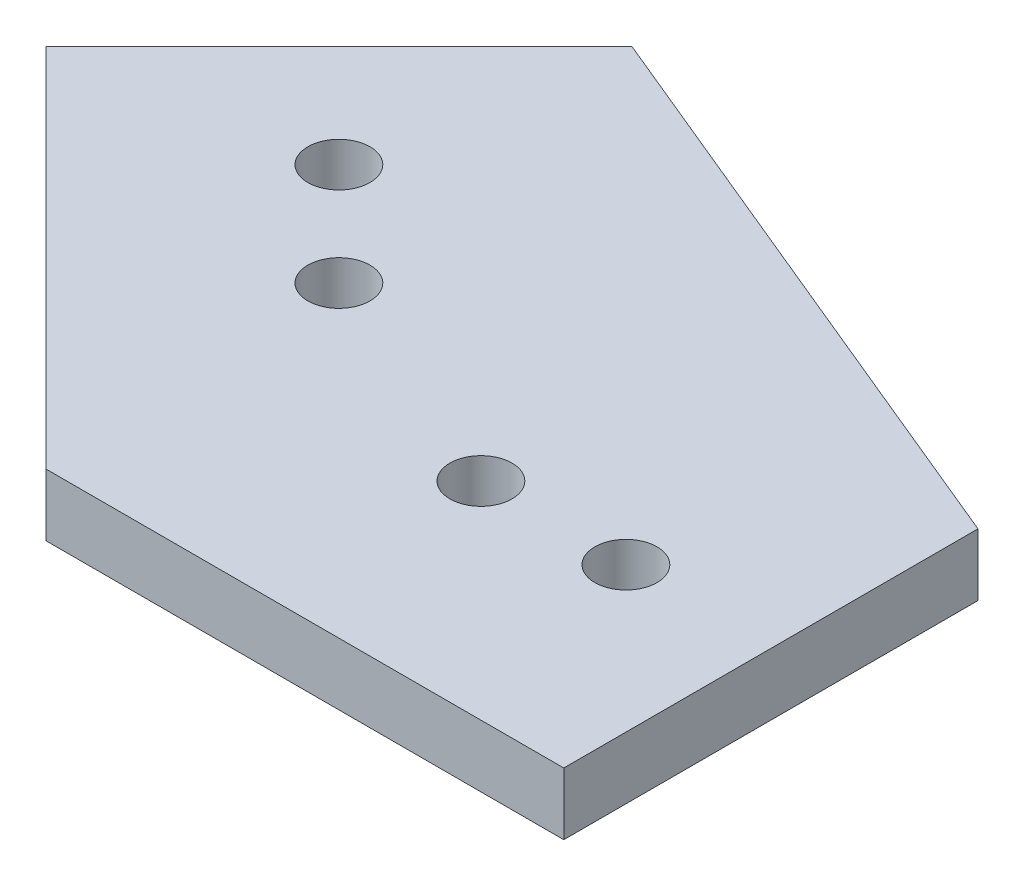
from build123d import *

# Parameters (mm, degrees)
SKETCH1_R           = 1.5
BOSS_EXTRUDE1_DEPTH = 3


with BuildPart() as part:
    # Sketch1 → Boss-Extrude1 (new body)
    with BuildSketch(Plane(origin=(0, 0, 0), x_dir=(1, 0, 0), z_dir=(0, 1, 0))):
        Polygon((0, 0), (25, 0), (25, 20), (-3.535533906, 31.819805153), (-17.67766953, 17.67766953), align=None)
        with Locations((18, 10)):
            Circle(SKETCH1_R, mode=Mode.SUBTRACT)
        with Locations((11, 10)):
            Circle(SKETCH1_R, mode=Mode.SUBTRACT)
        with Locations((-5.656854249, 19.798989873)):
            Circle(SKETCH1_R, mode=Mode.SUBTRACT)
        with Locations((-0.707106781, 14.849242405)):
            Circle(SKETCH1_R, mode=Mode.SUBTRACT)
    extrude(amount=BOSS_EXTRUDE1_DEPTH)


solid = part.part
